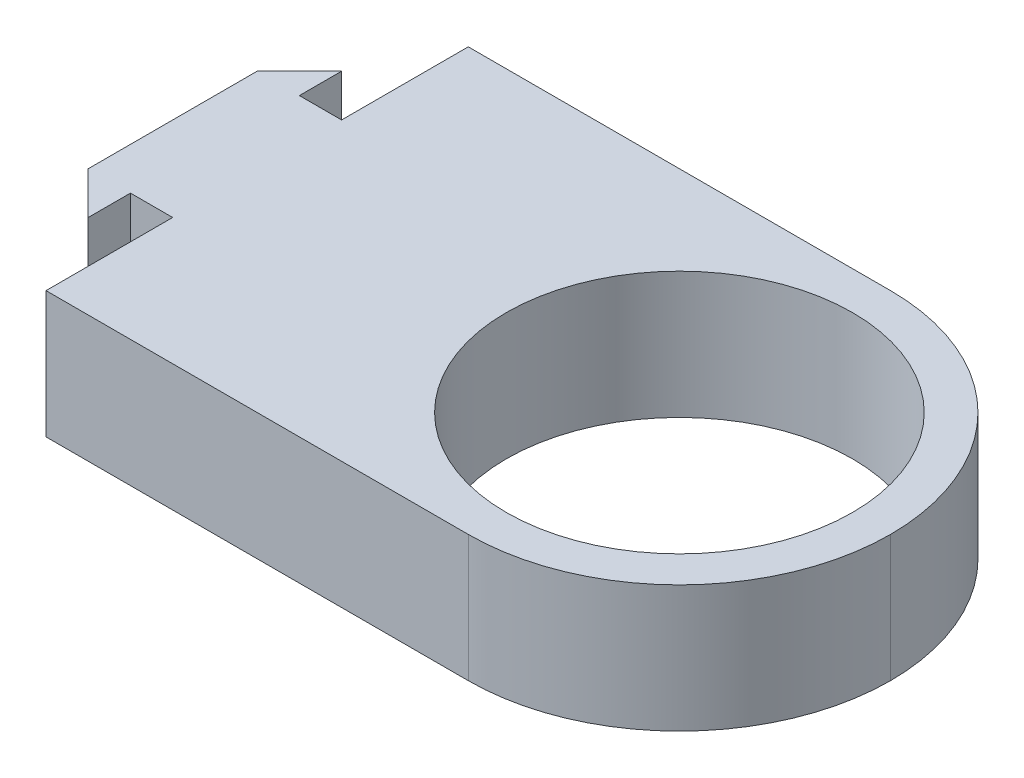
from build123d import *

# Parameters (mm, degrees)
ESBO_O1_W                = 30
ESBO_O1_H                = 20
RESSALTO_EXTRUS_O1_DEPTH = 3
ESBO_O2_R                = 8.2
CORTE_EXTRUS_O1_DEPTH    = 20
FILETE1_R                = 10
ESBO_O3_W                = 8
ESBO_O3_H                = 6
RESSALTO_EXTRUS_O2_DEPTH = 2
ESBO_O4_W                = 12
ESBO_O4_H                = 6
RESSALTO_EXTRUS_O3_DEPTH = 2
CHANFRO1_SIZE            = 2


with BuildPart() as part:
    # Esboço1 → Ressalto-extrusão1 (new, symmetric)
    with BuildSketch(Plane(origin=(0, 0, 0), x_dir=(1, 0, 0), z_dir=(0, 1, 0))):
        Rectangle(ESBO_O1_W, ESBO_O1_H)
    extrude(amount=RESSALTO_EXTRUS_O1_DEPTH, both=True)

    # Esboço2 → Corte-extrusão1 (cut, through all)
    with BuildSketch(Plane(origin=(0, 3, 0), x_dir=(1, 0, 0), z_dir=(0, 1, 0))):
        with Locations(Location((5, 0, 0), (0, 0, 270))):
            Circle(ESBO_O2_R)
    extrude(amount=-CORTE_EXTRUS_O1_DEPTH, mode=Mode.SUBTRACT)

    # Filete1
    filete1_edges = [part.edges().sort_by_distance(p)[0] for p in [
        (15, 0, -10),
        (15, 0, 10),
    ]]
    fillet(filete1_edges, radius=FILETE1_R - 0.0001)  # a hair under: the kernel refuses the full size

    # Esboço3 → Ressalto-extrusão2 (add)
    with BuildSketch(Plane.ZY.offset(15)):
        Rectangle(ESBO_O3_W, ESBO_O3_H)
    extrude(amount=RESSALTO_EXTRUS_O2_DEPTH)

    # Esboço4 → Ressalto-extrusão3 (add)
    with BuildSketch(Plane.ZY.offset(17)):
        Rectangle(ESBO_O4_W, ESBO_O4_H)
    extrude(amount=RESSALTO_EXTRUS_O3_DEPTH)

    # Chanfro1
    chanfro1_edges = [part.edges().sort_by_distance(p)[0] for p in [
        (-19, 0, 6),
        (-19, 0, -6),
    ]]
    chamfer(chanfro1_edges, length=CHANFRO1_SIZE - 0.0001)  # a hair under: the kernel refuses the full size


solid = part.part
